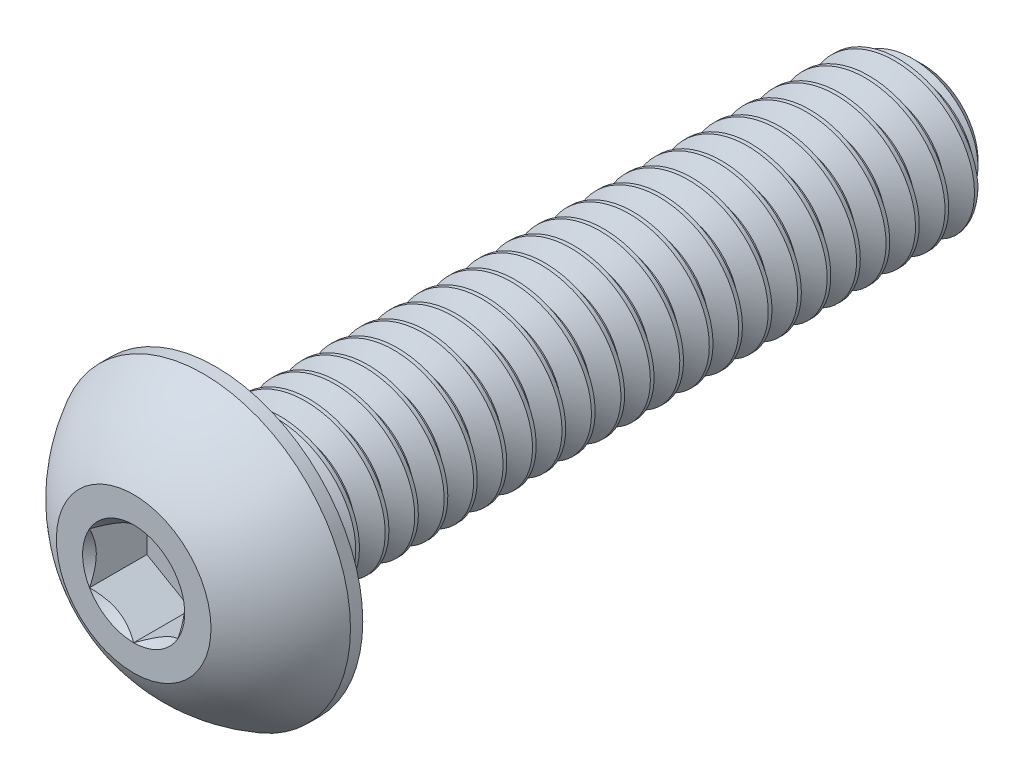
from build123d import *

# Parameters (mm, degrees)
SKETCH1_W          = 19.05
SKETCH1_H          = 2.0828
CHAMFER1_SIZE      = 0.5953125
CUT_SWEEP1_PITCH   = 0.79375
CUT_EXTRUDE2_DEPTH = 1.54686


with BuildPart() as part:
    # Sketch1 → Revolve1 (revolve)
    with BuildSketch(Plane(origin=(0, 0, 0), x_dir=(0, 0, -1), z_dir=(1, 0, 0))):
        with Locations((11.7348, 1.0414)):
            Rectangle(SKETCH1_W, SKETCH1_H)
    revolve(axis=Axis((0, 0, -21.2598), (0, 0, 1)))

    # Chamfer1
    chamfer1_edges = [part.edges().sort_by_distance(p)[0] for p in [
        (0, -2.0828, -21.2598),
    ]]
    chamfer(chamfer1_edges, length=CHAMFER1_SIZE)

    # Cut-Sweep1: arcs per turn and ends read off the stored shape
    # Cut-Sweep1: the profile of Sketch2 profile screwed along a right-hand helix through 25 turns, 8 arcs to a turn; built about Z, then put on its axis
    cut_sweep1_z = Axis((0, 0, 0), (0, 0, 1))
    cut_sweep1_corners = [(2.0831, 0, 0.000173205), (2.0831, 0, -0.694704455), (1.567244252, 0, -0.396875), (1.567244252, 0, -0.29765625)]
    with BuildLine(mode=Mode.PRIVATE) as cut_sweep1_profile:
        Line(cut_sweep1_corners[0], cut_sweep1_corners[1])
        Line(cut_sweep1_corners[1], cut_sweep1_corners[2])
        Line(cut_sweep1_corners[2], cut_sweep1_corners[3])
        Line(cut_sweep1_corners[3], cut_sweep1_corners[0])
    cut_sweep1_cap = Face(cut_sweep1_profile.wire())
    cut_sweep1_turn_angles = [0, 22.5, 45, 67.5, 90, 112.5, 135, 157.5, 180, 202.5, 225, 247.5, 270, 292.5, 315, 337.5, 360]
    cut_sweep1_turn_weights = [1, 0.9238795325112867, 1, 0.9238795325112867, 1, 0.9238795325112867, 1, 0.9238795325112867, 1, 0.9238795325112867, 1, 0.9238795325112867, 1, 0.9238795325112867, 1, 0.9238795325112867, 1]
    cut_sweep1_turn_rails = [Edge.make_bspline([Vector(p[0], p[1], 0).rotate(cut_sweep1_z, cut_sweep1_turn_angles[k]) / cut_sweep1_turn_weights[k] + Vector(0, 0, p[2] + CUT_SWEEP1_PITCH * cut_sweep1_turn_angles[k] / 360) for k in range(17)], [0, 0, 0, 1, 1, 2, 2, 3, 3, 4, 4, 5, 5, 6, 6, 7, 7, 8, 8, 8], 2, cut_sweep1_turn_weights) for p in cut_sweep1_corners]
    cut_sweep1_turn_sides = [Face.make_surface_from_curves(cut_sweep1_turn_rails[p[0]], cut_sweep1_turn_rails[p[1]]) for p in [(0, 1), (1, 2), (2, 3), (3, 0)]]
    cut_sweep1 = Plane(origin=(0, 0, -21.2598), x_dir=(0, 1, 0), z_dir=(0, 0, 1)) * Solid(Shell([*[p.moved(Location((0, 0, CUT_SWEEP1_PITCH * i))) for i in range(25) for p in cut_sweep1_turn_sides], cut_sweep1_cap, cut_sweep1_cap.rotate(cut_sweep1_z, 9000).moved(Location((0, 0, CUT_SWEEP1_PITCH * 9000 / 360)))]))
    add(cut_sweep1, mode=Mode.SUBTRACT)

    # Sketch7 → Revolve2 (revolve)
    with BuildSketch(Plane(origin=(0, 0, 0), x_dir=(0, 0, -1), z_dir=(1, 0, 0)), mode=Mode.PRIVATE) as revolve2_sk:
        with BuildLine():
            Line((1.87833, 3.9624), (2.2098, 3.9624))
            Line((2.2098, 3.9624), (2.2098, 0))
            Line((2.2098, 0), (0, 0))
            Line((0, 0), (0, 2.0828))
            ThreePointArc((0, 2.0828), (0.796523813, 3.165144808), (1.87833, 3.9624))
        make_face()
    revolve(revolve2_sk.sketch.rotate(Axis((0, 0, 0), (0, 0, -1)), 189.052465709), axis=Axis((0, 0, 0), (0, 0, -1)))

    # Sketch5 → Cut-Extrude2 (cut)
    with BuildSketch(Plane.XY):
        Polygon((1.190625, -0.687407664), (1.190625, 0.687407664), (0, 1.374815329), (-1.190625, 0.687407664), (-1.190625, -0.687407664), (0, -1.374815329), align=None)
    extrude(amount=-CUT_EXTRUDE2_DEPTH, mode=Mode.SUBTRACT)

    # Cut-Extrude3 cone 1 section (through the dimple's axis) → Cut-Extrude3 (revolve, cut)
    with BuildSketch(Plane(origin=(0, 0, 0), x_dir=(0, -1, 0), z_dir=(1, 0, 0))):
        Polygon((0, 0), (1.374815329, 0), (0, 1.374815329), align=None)
    revolve(axis=Axis((0, 0, 0), (0, 0, -1)), mode=Mode.SUBTRACT)


solid = part.part
